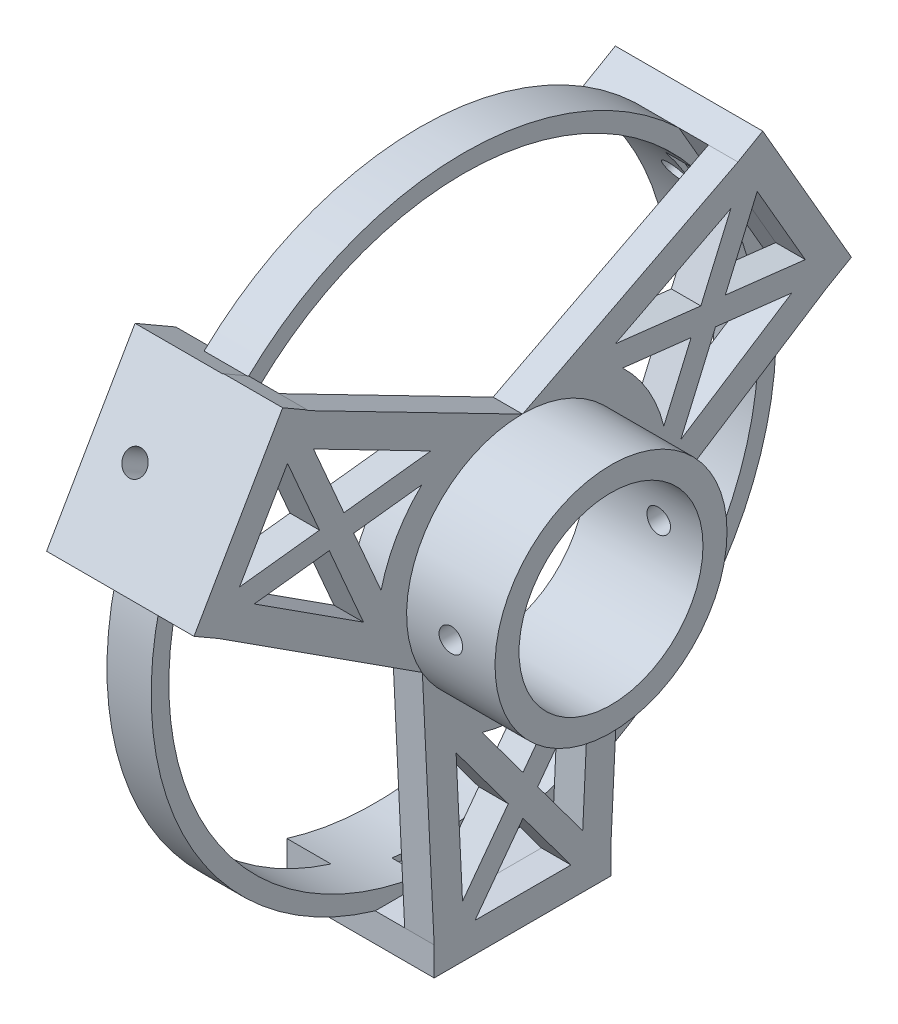
from build123d import *

# Parameters (mm, degrees)
EXTRUDE_START       = -15
EXTRUDE_1_DEPTH     = 15
EXTRUDE_START_2     = -7.5
SKETCH_2_R          = 53
SKETCH_2_R_2        = 50
EXTRUDE_2_DEPTH     = 7.5
SKETCH_3_R          = 2
CUT_EXTRUDE_1_DEPTH = 10
SKETCH_4_R          = 2
CUT_EXTRUDE_2_DEPTH = 10
SKETCH_5_R          = 2
CUT_EXTRUDE_3_DEPTH = 10
SKETCH_6_W          = 30
SKETCH_6_H          = 4.863899963
EXTRUDE_3_DEPTH     = 10
SKETCH_7_R          = 15.6
EXTRUDE_4_DEPTH     = 5
EXTRUDE_START_3     = 15
SKETCH_8_R          = 19.674554727
SKETCH_8_R_2        = 15.6
EXTRUDE_5_DEPTH     = 15
SKETCH_9_R          = 2
CUT_EXTRUDE_4_DEPTH = 131.86111959
CUT_EXTRUDE_5_DEPTH = 15


# Read off the part's stored shape, not the designer's step: 填料-伸長1
with BuildPart() as part:
    # 填料-伸長1 outline → 填料-伸長1 (new body)
    with BuildSketch(Plane(origin=(1.20571551, 0, 0), x_dir=(0, 0, -1), z_dir=(1, 0, 0)).offset(EXTRUDE_START)):
        with BuildLine():
            ThreePointArc((-28.891489898, 61.342870268), (-23.385980983, 75.484771289), (-13.891489898, 87.323632381))
            Line((-13.891489898, 87.323632381), (-20.819693129, 91.323632381))
            Line((-20.819693129, 91.323632381), (-35.819693129, 65.342870268))
            Line((-35.819693129, 65.342870268), (-28.891489898, 61.342870268))
        make_face()
        with BuildLine():
            ThreePointArc((34.915289206, 2.787811218), (19.915289206, 0.484771289), (4.915289206, 2.787811218))
            Line((4.915289206, 2.787811218), (4.915289206, -5.212188782))
            Line((4.915289206, -5.212188782), (34.915289206, -5.212188782))
            Line((34.915289206, -5.212188782), (34.915289206, 2.787811218))
        make_face()
        with BuildLine():
            ThreePointArc((53.722068311, 87.323632381), (63.216559396, 75.484771289), (68.722068311, 61.342870268))
            Line((68.722068311, 61.342870268), (75.650271541, 65.342870268))
            Line((75.650271541, 65.342870268), (60.650271541, 91.323632381))
            Line((60.650271541, 91.323632381), (53.722068311, 87.323632381))
        make_face()
    extrude(amount=EXTRUDE_1_DEPTH)

    # 草圖2 → 填料-伸長2 (add)
    with BuildSketch(Plane(origin=(1.20571551, 0, 0), x_dir=(0, 0, -1), z_dir=(1, 0, 0)).offset(EXTRUDE_START_2)):
        with Locations((19.915289206, 50.484771289)):
            Circle(SKETCH_2_R)
        with Locations((19.915289206, 50.484771289)):
            Circle(SKETCH_2_R_2, mode=Mode.SUBTRACT)
    extrude(amount=EXTRUDE_2_DEPTH)

    # 草圖3 → 除料-伸長1 (cut)
    with BuildSketch(Plane(origin=(0, 31.846099669, 55.15906265), x_dir=(1, 0, 0), z_dir=(0, 0.5000000000000088, 0.8660254037844337))):
        with Locations(Location((-6.29428449, 53.678739044, 0), (0, 0, 270))):
            Circle(SKETCH_3_R)
    extrude(amount=-CUT_EXTRUDE_1_DEPTH, mode=Mode.SUBTRACT)

    # 草圖4 → 除料-伸長2 (cut)
    with BuildSketch(Plane.XZ.offset(5.212188782)):
        with Locations(Location((-6.29428449, -19.915289206, 0), (0, 0, 270))):
            Circle(SKETCH_4_R)
    extrude(amount=-CUT_EXTRUDE_2_DEPTH, mode=Mode.SUBTRACT)

    # 草圖5 → 除料-伸長3 (cut)
    with BuildSketch(Plane(origin=(0, 49.093246046, -85.03199646), x_dir=(-1, 0, 0), z_dir=(0, 0.5000000000000044, -0.8660254037844362))):
        with Locations(Location((6.29428449, 33.763449837, 0), (0, 0, 90))):
            Circle(SKETCH_5_R)
    extrude(amount=-CUT_EXTRUDE_3_DEPTH, mode=Mode.SUBTRACT)

    # 草圖6 → 填料-伸長3 (add)
    with BuildSketch(Plane(origin=(1.20571551, 0, 0), x_dir=(0, 0, -1), z_dir=(1, 0, 0))):
        Polygon((-35.819693129, 65.342870268), (-31.6074322, 62.910920287), (-16.564749505, 88.965610996), (-20.777010434, 91.397560977), align=None)
        with Locations((19.915289206, -2.780238801)):
            Rectangle(SKETCH_6_W, SKETCH_6_H)
        Polygon((60.650271541, 91.323632381), (56.438010612, 88.8916824), (71.476544096, 62.844178335), (75.688805025, 65.276128316), align=None)
    extrude(amount=EXTRUDE_3_DEPTH)

    # 草圖7 → 填料-伸長4 (add)
    with BuildSketch(Plane(origin=(11.20571551, 0, 0), x_dir=(0, 0, -1), z_dir=(1, 0, 0))):
        Polygon((4.915289206, -0.348288819), (34.915289206, -0.348288819), (36.915289206, 40.580827444), (71.476544096, 62.844178335), (56.438010612, 88.8916824), (19.915289206, 70.114680442), (-16.6074322, 88.8916824), (-31.6074322, 62.910920287), (2.915289206, 40.669816713), align=None)
        with Locations((19.915289206, 50.484771289)):
            Circle(SKETCH_7_R, mode=Mode.SUBTRACT)
    extrude(amount=-EXTRUDE_4_DEPTH)

    # 草圖8 → 填料-伸長5 (add)
    with BuildSketch(Plane(origin=(11.20571551, 0, 0), x_dir=(0, 0, -1), z_dir=(1, 0, 0)).offset(EXTRUDE_START_3)):
        with Locations(Location((19.915289206, 50.484771289, 0), (0, 0, 209.748184736))):
            Circle(SKETCH_8_R)
        with Locations((19.915289206, 50.484771289)):
            Circle(SKETCH_8_R_2, mode=Mode.SUBTRACT)
    extrude(amount=-EXTRUDE_5_DEPTH)

    # 草圖9 → 除料-伸長4 (cut, through all)
    with BuildSketch(Plane.XY):
        with Locations((18.70571551, 50.484771289)):
            Circle(SKETCH_9_R)
    extrude(amount=-CUT_EXTRUDE_4_DEPTH, mode=Mode.SUBTRACT)

    # 草圖10 → 除料-伸長5 (cut)
    with BuildSketch(Plane(origin=(11.20571551, 0, 0), x_dir=(0, 0, -1), z_dir=(1, 0, 0))):
        Polygon((17.489472579, 14.095645642), (8.635822473, 26.014186948), (9.726460643, 3.646231166), align=None)
        Polygon((4.362874888, 72.488368192), (-15.553662135, 82.727825721), (-10.385709712, 70.780152937), align=None)
        with BuildLine():
            Line((19.981027019, 17.44940643), (26.954063356, 26.835473003))
            ThreePointArc((26.954063356, 26.835473003), (20.003346412, 25.81037369), (13.045489926, 26.785836528))
            Line((13.045489926, 26.785836528), (19.981027019, 17.44940643))
        make_face()
        Polygon((-19.953437634, 82.824030911), (-28.090922206, 68.729494185), (-14.535949667, 70.299462525), align=None)
        Polygon((22.472437105, 14.095538404), (31.188411686, 25.827689753), (30.112548712, 3.810629391), align=None)
        Polygon((-25.60433313, 64.990756457), (-7.074931027, 53.05050161), (-12.877284846, 66.464832691), align=None)
        with BuildLine():
            Line((-8.727044891, 66.945523102), (-4.084990966, 56.213663207))
            ThreePointArc((-4.084990966, 56.213663207), (-1.49739454, 62.745710311), (2.826309301, 68.283659365))
            Line((2.826309301, 68.283659365), (-8.727044891, 66.945523102))
        make_face()
        Polygon((11.843032254, -0.212188782), (28.1180014, -0.212188782), (19.980882665, 10.741777615), align=None)
        Polygon((46.747170258, 52.951758728), (65.573069111, 65.080256981), (52.642104752, 66.578515289), align=None)
        Polygon((67.856272998, 68.842471738), (59.718788426, 82.937008464), (54.300934622, 70.413073728), align=None)
        Polygon((55.237652037, 82.652928019), (35.632386961, 72.576122504), (50.15071536, 70.893942773), align=None)
        with BuildLine():
            Line((48.491885491, 67.059384335), (36.876795229, 68.405177657))
            ThreePointArc((36.876795229, 68.405177657), (41.239915747, 62.898229866), (43.874068392, 56.384817974))
            Line((43.874068392, 56.384817974), (48.491885491, 67.059384335))
        make_face()
    extrude(amount=-CUT_EXTRUDE_5_DEPTH, mode=Mode.SUBTRACT)


solid = part.part
